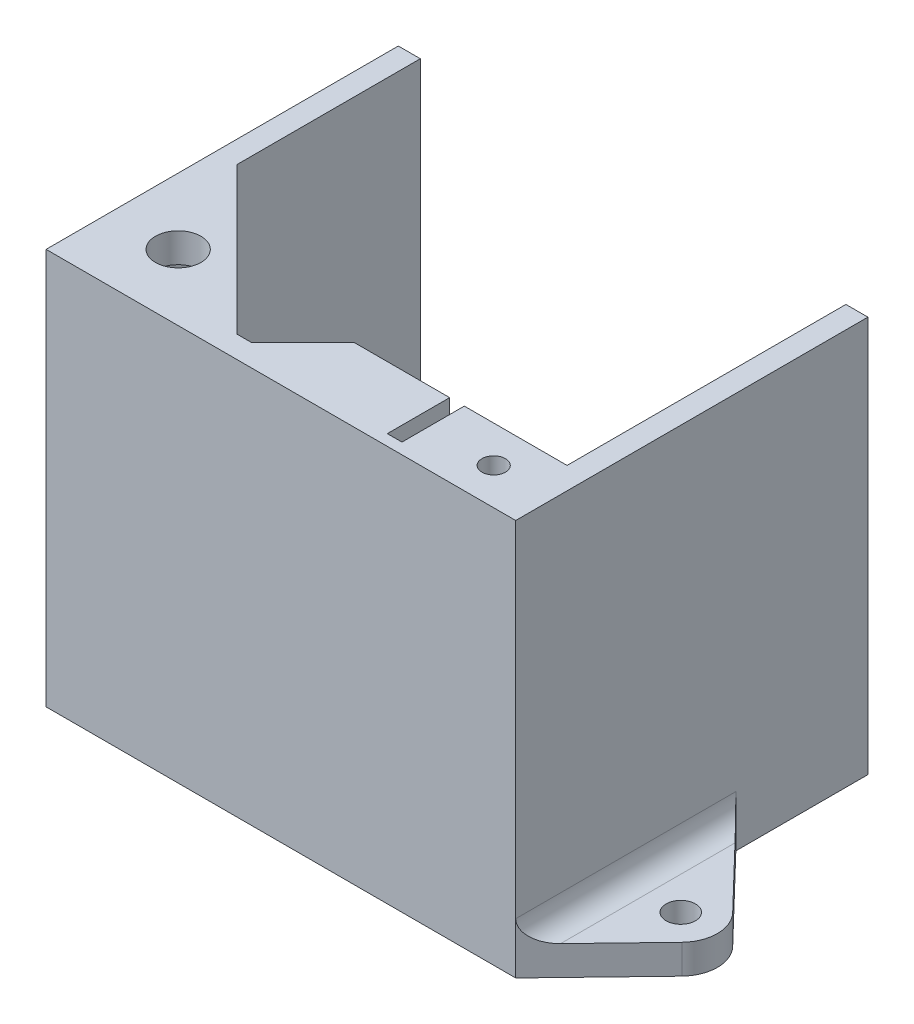
from build123d import *

# Parameters (mm, degrees)
SKETCH1_W           = 64
SKETCH1_H           = 48
BOSS_EXTRUDE1_DEPTH = 4
CUT_EXTRUDE1_DEPTH  = 2.4
CUT_EXTRUDE2_DEPTH  = 2.4
BOSS_EXTRUDE3_DEPTH = 50
BOSS_EXTRUDE4_DEPTH = 50
CUT_EXTRUDE4_DEPTH  = 9.5
SKETCH13_W          = 36.946258726
SKETCH13_H          = 1
CUT_EXTRUDE6_DEPTH  = 32
SKETCH15_R          = 3.1
BOSS_EXTRUDE5_DEPTH = 4
CUT_EXTRUDE7_DEPTH  = 7
SKETCH18_W          = 5.6
SKETCH18_H          = 2.5
CUT_EXTRUDE8_DEPTH  = 5
SKETCH19_W          = 6.595396426
SKETCH19_H          = 7.197552374
SKETCH19_R          = 1.6
BOSS_EXTRUDE8_DEPTH = 4.5
FILLET1_R           = 1.5
SKETCH20_R          = 2
BOSS_EXTRUDE9_DEPTH = 4
FILLET2_R           = 3
SKETCH22_R          = 1.65
CUT_EXTRUDE9_DEPTH  = 2


with BuildPart() as part:
    # Sketch1 → Boss-Extrude1 (new body)
    with BuildSketch(Plane(origin=(0, 0, 0), x_dir=(1, 0, 0), z_dir=(0, 1, 0))):
        Rectangle(SKETCH1_W, SKETCH1_H)
    extrude(amount=BOSS_EXTRUDE1_DEPTH)

    # Sketch2 → Cut-Extrude1 (cut)
    with BuildSketch(Plane.XZ):
        Polygon((-20.651368439, -16), (-22.325684219, -13.1), (-25.674315781, -13.1), (-27.348631561, -16), (-25.674315781, -18.9), (-22.325684219, -18.9), align=None)
    extrude(amount=-CUT_EXTRUDE1_DEPTH, mode=Mode.SUBTRACT)

    # Sketch4 → Cut-Extrude2 (cut)
    with BuildSketch(Plane.XZ):
        Polygon((9.348631561, 10), (7.674315781, 12.9), (4.325684219, 12.9), (2.651368439, 10), (4.325684219, 7.1), (7.674315781, 7.1), align=None)
    extrude(amount=-CUT_EXTRUDE2_DEPTH, mode=Mode.SUBTRACT)

    # Sketch6 → Boss-Extrude3 (add)
    with BuildSketch(Plane(origin=(0, 4, 0), x_dir=(1, 0, 0), z_dir=(0, 1, 0))):
        Polygon((-29, -21), (-29, 21), (-29, 24), (-32, 24), (-32, -24), (32, -24), (32, 24), (29, 24), (29, 21), (29, -21), align=None)
    extrude(amount=BOSS_EXTRUDE3_DEPTH)

    # Sketch9 → Boss-Extrude4 (add)
    with BuildSketch(Plane(origin=(0, 4, 0), x_dir=(1, 0, 0), z_dir=(0, 1, 0))):
        Polygon((29, -13), (1, -13), (-7, -21), (29, -21), align=None)
    extrude(amount=BOSS_EXTRUDE4_DEPTH)

    # Sketch10 → Cut-Extrude4 (cut)
    with BuildSketch(Plane(origin=(0, 0, 13), x_dir=(-1, 0, 0), z_dir=(0, 0, -1))):
        Polygon((-14.998616503, 39), (-27, 39), (-27, 13), (-1, 13), (-1, 39), (-13.001383497, 39), (-13.001383497, 54), (-14.998616503, 54), align=None)
    extrude(amount=-CUT_EXTRUDE4_DEPTH, mode=Mode.SUBTRACT)

    # Sketch13 → Cut-Extrude6 (cut)
    with BuildSketch(Plane(origin=(0, 54, 0), x_dir=(1, 0, 0), z_dir=(0, 1, 0))):
        with Locations((10.526870637, -13.5)):
            Rectangle(SKETCH13_W, SKETCH13_H)
    extrude(amount=-CUT_EXTRUDE6_DEPTH, mode=Mode.SUBTRACT)

    # Sketch15 → Boss-Extrude5 (add)
    with BuildSketch(Plane(origin=(0, 54, 0), x_dir=(1, 0, 0), z_dir=(0, 1, 0))):
        Polygon((-29, -1), (-9, -21), (-29, -21), align=None)
        with Locations((-23, -15)):
            Circle(SKETCH15_R, mode=Mode.SUBTRACT)
    extrude(amount=-BOSS_EXTRUDE5_DEPTH)

    # Sketch17 → Cut-Extrude7 (cut)
    with BuildSketch(Plane(origin=(0, 54, 0), x_dir=(1, 0, 0), z_dir=(0, 1, 0))):
        Polygon((24, -15.824573519), (21.25, -17.41228676), (21.25, -20.58771324), (24, -22.175426481), (26.75, -20.58771324), (26.75, -17.41228676), align=None)
    extrude(amount=-CUT_EXTRUDE7_DEPTH, mode=Mode.SUBTRACT)

    # Sketch18 → Cut-Extrude8 (cut)
    with BuildSketch(Plane(origin=(0, 0, 14), x_dir=(-1, 0, 0), z_dir=(0, 0, -1))):
        with Locations((-24, 48.25)):
            Rectangle(SKETCH18_W, SKETCH18_H)
    extrude(amount=-CUT_EXTRUDE8_DEPTH, mode=Mode.SUBTRACT)

    # Sketch19 → Boss-Extrude8 (add)
    with BuildSketch(Plane(origin=(0, 54, 0), x_dir=(1, 0, 0), z_dir=(0, 1, 0))):
        with Locations((24, -19)):
            Rectangle(SKETCH19_W, SKETCH19_H)
        with Locations((24, -19)):
            Circle(SKETCH19_R, mode=Mode.SUBTRACT)
    extrude(amount=-BOSS_EXTRUDE8_DEPTH)

    # Fillet1
    fillet1_edges = [part.edges().sort_by_distance(p)[0] for p in [
        (-29, 50, 11),
        (-19, 50, 21),
    ]]
    fillet(fillet1_edges, radius=FILLET1_R)

    # Sketch20 → Boss-Extrude9 (add)
    # profile 1 of 2: a face of its own
    with BuildSketch(Plane.XZ):
        with BuildLine():
            Line((43.102082828, 12.467708073), (32.000000003, 23.999999995))
            Line((32.000000003, 23.999999995), (32, -6.000000006))
            Line((32, -6.000000006), (43.102082826, 5.532291913))
            ThreePointArc((43.102082826, 5.532291913), (44.500000003, 8.999999993), (43.102082828, 12.467708073))
        make_face()
        with Locations((39.500000002, 8.999999994)):
            Circle(SKETCH20_R, mode=Mode.SUBTRACT)
    # profile 2 of 2: a face of its own
    with BuildSketch(Plane.XZ):
        with BuildLine():
            Line((-32, -24), (-32, 2.000000002))
            Line((-32, 2.000000002), (-42.978939192, -7.408763151))
            ThreePointArc((-42.978939192, -7.408763151), (-44.499999999, -10.999999999), (-42.978939192, -14.591236846))
            Line((-42.978939192, -14.591236846), (-32, -24))
        make_face()
        with Locations((-39.499999999, -10.999999999)):
            Circle(SKETCH20_R, mode=Mode.SUBTRACT)
    extrude(amount=-BOSS_EXTRUDE9_DEPTH)

    # Fillet2
    fillet2_edges = [part.edges().sort_by_distance(p)[0] for p in [
        (-32, 4, -10.999999999),
        (32.000000002, 4, 8.999999995),
    ]]
    fillet(fillet2_edges, radius=FILLET2_R)

    # Sketch22 → Cut-Extrude9 (cut)
    with BuildSketch(Plane.XZ.offset(-2.4)):
        with Locations((-24, -16)):
            Circle(SKETCH22_R)
        with Locations((6, 10)):
            Circle(SKETCH22_R)
    extrude(amount=-CUT_EXTRUDE9_DEPTH, mode=Mode.SUBTRACT)


solid = part.part
